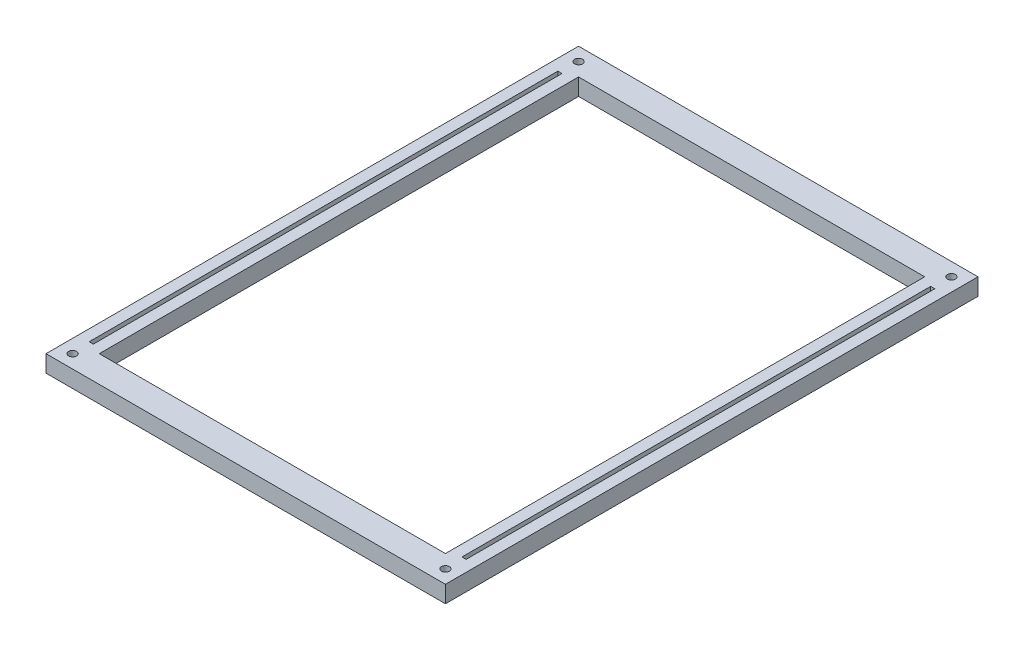
from build123d import *

# Parameters (mm, degrees)
SKETCH1_W          = 150
SKETCH1_H          = 200
SKETCH1_W_2        = 130
SKETCH1_H_2        = 180
MAINBODY_DEPTH     = 3.175
SHEETLOCK_REACH    = 127.161
SKETCH2_W          = 1.55575
SKETCH2_H          = 176
SUPPORTHOLES_REACH = 127.161
SKETCH3_R          = 1.5


with BuildPart() as part:
    # Sketch1 → MainBody (new, symmetric)
    with BuildSketch(Plane(origin=(0, 0, 0), x_dir=(1, 0, 0), z_dir=(0, 1, 0))):
        Rectangle(SKETCH1_W, SKETCH1_H)
        Rectangle(SKETCH1_W_2, SKETCH1_H_2, mode=Mode.SUBTRACT)
    extrude(amount=MAINBODY_DEPTH, both=True)

    # Sketch2 → SheetLock (cut, up to next)
    with BuildSketch(Plane(origin=(0, 3.175, 0), x_dir=(1, 0, 0), z_dir=(0, 1, 0)), mode=Mode.PRIVATE) as sheetlock_sk1:
        with Locations((-70, 0)):
            Rectangle(SKETCH2_W, SKETCH2_H)
    sheetlock_tool1 = extrude(sheetlock_sk1.sketch, amount=-SHEETLOCK_REACH, mode=Mode.PRIVATE) & part.part
    sheetlock = sheetlock_tool1.solids().sort_by_distance((-70, 3.175, 0))[0]
    add(sheetlock, mode=Mode.SUBTRACT)

    # Mirror1: SheetLock across plane
    add(sheetlock.mirror(Plane(origin=(0, 0, 0), x_dir=(0, 0, 1), z_dir=(1, 0, 0))), mode=Mode.SUBTRACT)

    # Sketch3 → SupportHoles (cut, up to next)
    with BuildSketch(Plane(origin=(0, 3.175, 0), x_dir=(1, 0, 0), z_dir=(0, 1, 0)), mode=Mode.PRIVATE) as supportholes_sk1:
        with Locations((-70, 95)):
            Circle(SKETCH3_R)
    supportholes_tool1 = extrude(supportholes_sk1.sketch, amount=-SUPPORTHOLES_REACH, mode=Mode.PRIVATE) & part.part
    # Sketch3 → SupportHoles (cut, up to next)
    with BuildSketch(Plane(origin=(0, 3.175, 0), x_dir=(1, 0, 0), z_dir=(0, 1, 0)), mode=Mode.PRIVATE) as supportholes_sk2:
        with Locations((70, 95)):
            Circle(SKETCH3_R)
    supportholes_tool2 = extrude(supportholes_sk2.sketch, amount=-SUPPORTHOLES_REACH, mode=Mode.PRIVATE) & part.part
    # Sketch3 → SupportHoles (cut, up to next)
    with BuildSketch(Plane(origin=(0, 3.175, 0), x_dir=(1, 0, 0), z_dir=(0, 1, 0)), mode=Mode.PRIVATE) as supportholes_sk3:
        with Locations((70, -95)):
            Circle(SKETCH3_R)
    supportholes_tool3 = extrude(supportholes_sk3.sketch, amount=-SUPPORTHOLES_REACH, mode=Mode.PRIVATE) & part.part
    # Sketch3 → SupportHoles (cut, up to next)
    with BuildSketch(Plane(origin=(0, 3.175, 0), x_dir=(1, 0, 0), z_dir=(0, 1, 0)), mode=Mode.PRIVATE) as supportholes_sk4:
        with Locations((-70, -95)):
            Circle(SKETCH3_R)
    supportholes_tool4 = extrude(supportholes_sk4.sketch, amount=-SUPPORTHOLES_REACH, mode=Mode.PRIVATE) & part.part
    add(supportholes_tool1.solids().sort_by_distance((-70, 3.175, -95))[0], mode=Mode.SUBTRACT)
    add(supportholes_tool2.solids().sort_by_distance((70, 3.175, -95))[0], mode=Mode.SUBTRACT)
    add(supportholes_tool3.solids().sort_by_distance((70, 3.175, 95))[0], mode=Mode.SUBTRACT)
    add(supportholes_tool4.solids().sort_by_distance((-70, 3.175, 95))[0], mode=Mode.SUBTRACT)


solid = part.part
